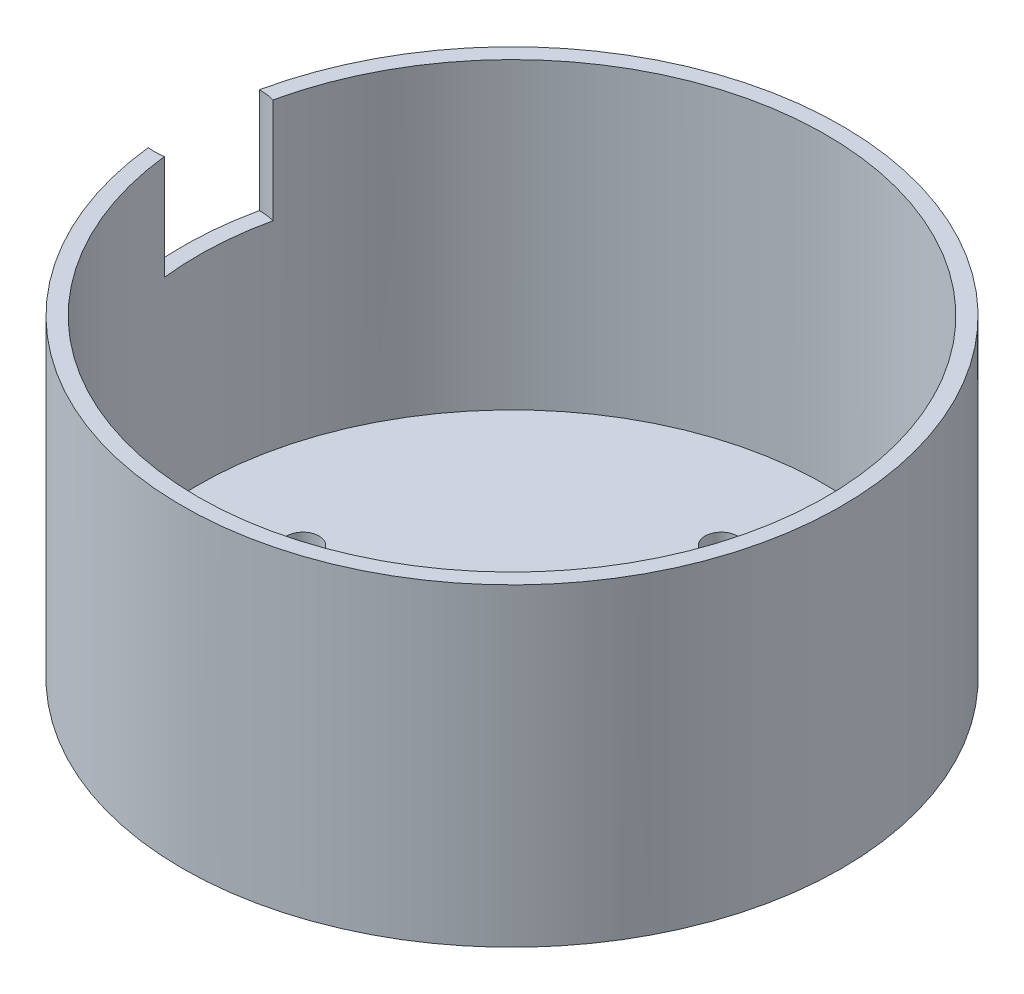
from build123d import *

# Parameters (mm, degrees)
SKETCH1_R           = 31.5
BOSS_EXTRUDE2_DEPTH = 30
SKETCH2_R           = 30
CUT_EXTRUDE1_DEPTH  = 29
SKETCH3_R           = 1.55
CUT_EXTRUDE2_DEPTH  = 54.70754137
CUT_EXTRUDE3_START  = 20
CUT_EXTRUDE3_DEPTH  = 10


# Read off the part's stored shape, not the designer's step: Cut-Extrude3
with BuildPart() as part:
    # Sketch1 → Boss-Extrude2 (new body)
    with BuildSketch(Plane(origin=(0, 0, 0), x_dir=(1, 0, 0), z_dir=(0, 1, 0))):
        with Locations(Location((0, 0, 0), (0, 0, 270))):
            Circle(SKETCH1_R)
    extrude(amount=BOSS_EXTRUDE2_DEPTH)

    # Sketch2 → Cut-Extrude1 (cut)
    with BuildSketch(Plane(origin=(0, 30, 0), x_dir=(1, 0, 0), z_dir=(0, 1, 0))):
        with Locations(Location((0, 0, 0), (0, 0, 270))):
            Circle(SKETCH2_R)
    extrude(amount=-CUT_EXTRUDE1_DEPTH, mode=Mode.SUBTRACT)

    # Sketch3 → Cut-Extrude2 (cut, through all)
    with BuildSketch(Plane.XZ):
        with Locations(Location((0, 20, 0), (0, 0, 270))):
            Circle(SKETCH3_R)
        with Locations(Location((-20, 0, 0), (0, 0, 270))):
            Circle(SKETCH3_R)
        with Locations(Location((0, -20, 0), (0, 0, 270))):
            Circle(SKETCH3_R)
        with Locations(Location((20, 0, 0), (0, 0, 270))):
            Circle(SKETCH3_R)
    extrude(amount=-CUT_EXTRUDE2_DEPTH, mode=Mode.SUBTRACT)

    # Cut-Extrude3 outline → Cut-Extrude3 (cut)
    with BuildSketch(Plane(origin=(0, 0, 0), x_dir=(1, 0, 0), z_dir=(0, 1, 0)).offset(CUT_EXTRUDE3_START)):
        with BuildLine():
            ThreePointArc((-29.299835483, 6.443573593), (-30.039033671, 6.596315408), (-30.792713244, 6.637681152))
            ThreePointArc((-30.792713244, 6.637681152), (-31.45908722, 1.604939654), (-31.308347945, -3.469488288))
            ThreePointArc((-31.308347945, -3.469488288), (-30.554371668, -3.505038211), (-29.803467005, -3.428316566))
            ThreePointArc((-29.803467005, -3.428316566), (-29.961035448, 1.528513956), (-29.299835483, 6.443573593))
        make_face()
    extrude(amount=CUT_EXTRUDE3_DEPTH, mode=Mode.SUBTRACT)


solid = part.part
